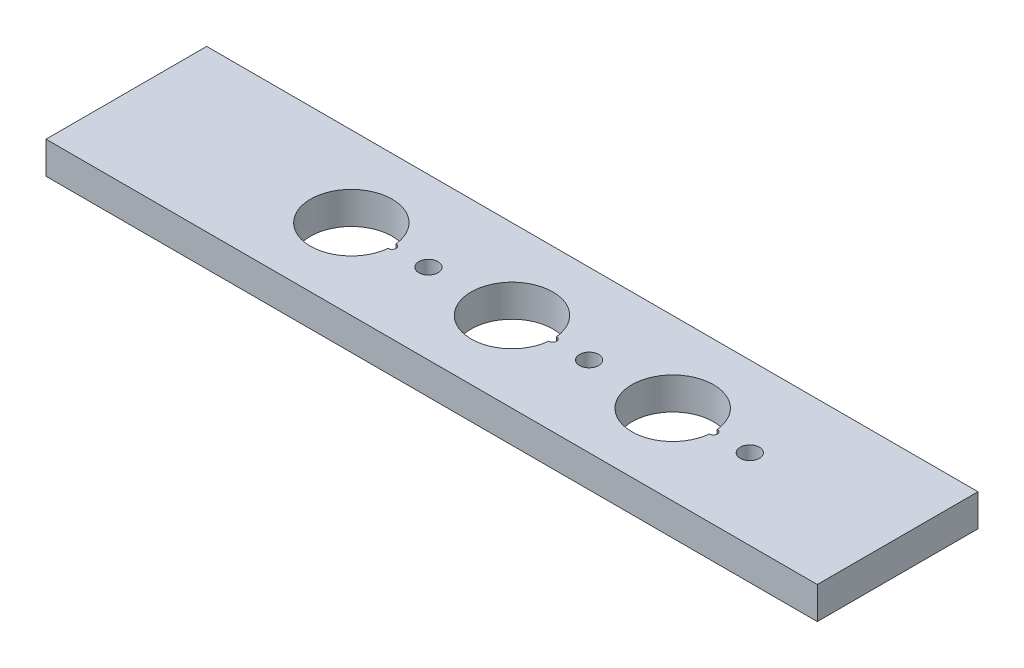
from build123d import *

# Parameters (mm, degrees)
SKETCH1_W           = 120
SKETCH1_H           = 25
SKETCH1_R           = 1.5
BOSS_EXTRUDE1_DEPTH = 5


with BuildPart() as part:
    # Sketch1 → Boss-Extrude1 (new body)
    with BuildSketch(Plane(origin=(0, 0, 0), x_dir=(1, 0, 0), z_dir=(0, 1, 0))):
        Rectangle(SKETCH1_W, SKETCH1_H)
        with Locations((37, 0)):
            Circle(SKETCH1_R, mode=Mode.SUBTRACT)
        with Locations((12, 0)):
            Circle(SKETCH1_R, mode=Mode.SUBTRACT)
        with Locations((-13, 0)):
            Circle(SKETCH1_R, mode=Mode.SUBTRACT)
        with BuildLine():
            ThreePointArc((31.321653543, 0.599330025), (31.95, 0), (31.321653543, -0.599330025))
            ThreePointArc((31.321653543, -0.599330025), (18.65, 0), (31.321653543, 0.599330025))
        make_face(mode=Mode.SUBTRACT)
        with BuildLine():
            ThreePointArc((6.321653543, 0.599330025), (6.95, 0), (6.321653543, -0.599330025))
            ThreePointArc((6.321653543, -0.599330025), (-6.35, 0), (6.321653543, 0.599330025))
        make_face(mode=Mode.SUBTRACT)
        with BuildLine():
            ThreePointArc((-18.678346457, 0.599330025), (-18.05, 0), (-18.678346457, -0.599330025))
            ThreePointArc((-18.678346457, -0.599330025), (-31.35, 0), (-18.678346457, 0.599330025))
        make_face(mode=Mode.SUBTRACT)
    extrude(amount=BOSS_EXTRUDE1_DEPTH)


solid = part.part
